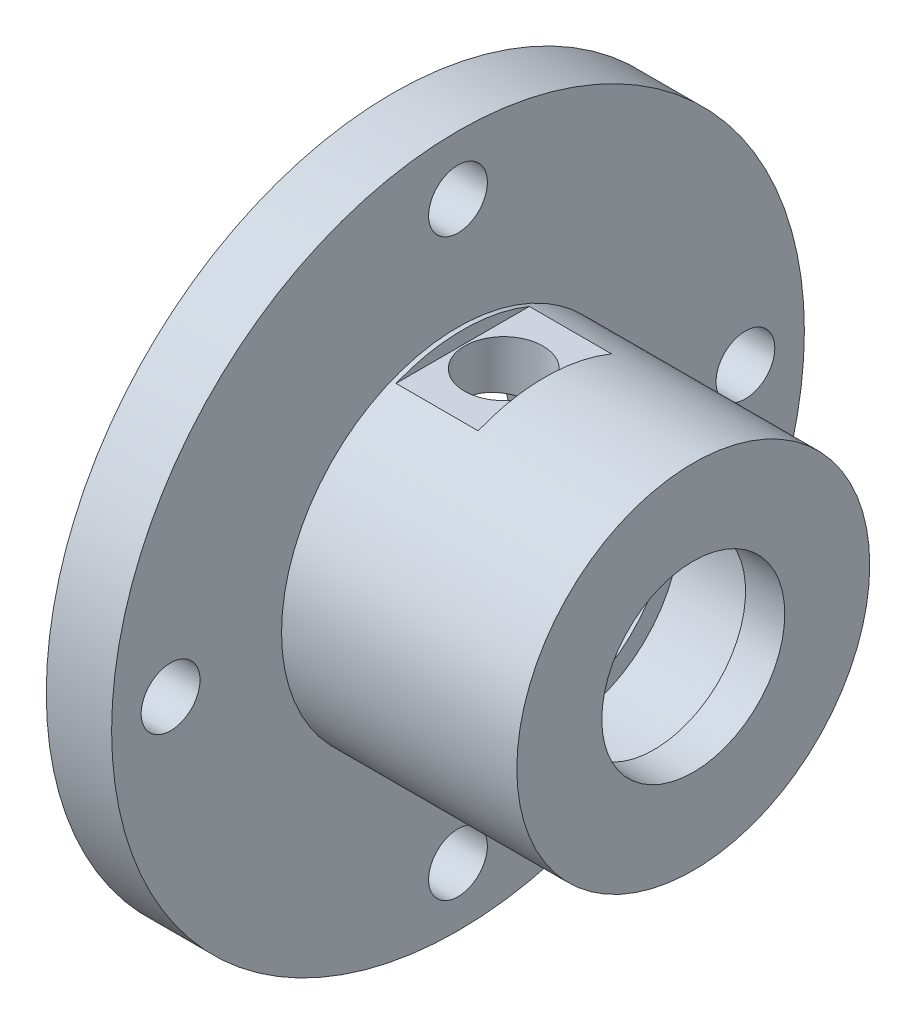
from build123d import *

# Parameters (mm, degrees)
SKETCH1_R           = 26.5
SKETCH1_R_2         = 2.25
BOSS_EXTRUDE1_DEPTH = 11.5
CUT_EXTRUDE1_START  = -18
SKETCH2_R           = 26.5
SKETCH2_R_2         = 2.25
SKETCH2_R_3         = 13.5
CUT_EXTRUDE1_DEPTH  = 18
SKETCH3_R           = 9
CUT_EXTRUDE2_DEPTH  = 20
SKETCH4_R           = 7
CUT_EXTRUDE3_DEPTH  = 20
SKETCH5_R           = 11
CUT_EXTRUDE4_DEPTH  = 0.5
SKETCH6_R           = 3
CUT_EXTRUDE5_DEPTH  = 33
SKETCH8_W           = 6.282269922
SKETCH8_H           = 12
CUT_EXTRUDE6_DEPTH  = 1


with BuildPart() as part:
    # Sketch1 → Boss-Extrude1 (new, symmetric)
    with BuildSketch(Plane(origin=(0, 0, 0), x_dir=(0, 0, -1), z_dir=(1, 0, 0))):
        Circle(SKETCH1_R)
        with Locations((0, -21.987670406)):
            Circle(SKETCH1_R_2, mode=Mode.SUBTRACT)
        with Locations((-21.987670406, 0)):
            Circle(SKETCH1_R_2, mode=Mode.SUBTRACT)
        with Locations((0, 21.987670406)):
            Circle(SKETCH1_R_2, mode=Mode.SUBTRACT)
        with Locations((21.987670406, 0)):
            Circle(SKETCH1_R_2, mode=Mode.SUBTRACT)
    extrude(amount=BOSS_EXTRUDE1_DEPTH, both=True)

    # Sketch2 → Cut-Extrude1 (cut)
    with BuildSketch(Plane(origin=(11.5, 0, 0), x_dir=(0, 0, -1), z_dir=(1, 0, 0)).offset(CUT_EXTRUDE1_START)):
        Circle(SKETCH2_R)
        with Locations((0, -21.987670406)):
            Circle(SKETCH2_R_2, mode=Mode.SUBTRACT)
        with Locations((-21.987670406, 0)):
            Circle(SKETCH2_R_2, mode=Mode.SUBTRACT)
        with Locations((0, 21.987670406)):
            Circle(SKETCH2_R_2, mode=Mode.SUBTRACT)
        Circle(SKETCH2_R_3, mode=Mode.SUBTRACT)
        with Locations((21.987670406, 0)):
            Circle(SKETCH2_R_2, mode=Mode.SUBTRACT)
    extrude(amount=CUT_EXTRUDE1_DEPTH, mode=Mode.SUBTRACT)

    # Sketch3 → Cut-Extrude2 (cut)
    with BuildSketch(Plane.ZY.offset(11.5)):
        Circle(SKETCH3_R)
    extrude(amount=-CUT_EXTRUDE2_DEPTH, mode=Mode.SUBTRACT)

    # Sketch4 → Cut-Extrude3 (cut)
    with BuildSketch(Plane.ZY.offset(-8.5)):
        Circle(SKETCH4_R)
    extrude(amount=-CUT_EXTRUDE3_DEPTH, mode=Mode.SUBTRACT)

    # Sketch5 → Cut-Extrude4 (cut, symmetric)
    with BuildSketch(Plane.ZY.offset(-1)):
        Circle(SKETCH5_R)
    extrude(amount=CUT_EXTRUDE4_DEPTH, both=True, mode=Mode.SUBTRACT)

    # Sketch6 → Cut-Extrude5 (cut)
    with BuildSketch(Plane(origin=(0, 0, 0), x_dir=(1, 0, 0), z_dir=(0, 1, 0))):
        with Locations((-3, 0)):
            Circle(SKETCH6_R)
    extrude(amount=CUT_EXTRUDE5_DEPTH, mode=Mode.SUBTRACT)

    # Sketch8 → Cut-Extrude6 (cut)
    with BuildSketch(Plane(origin=(0, 13.5, 0), x_dir=(1, 0, 0), z_dir=(0, 1, 0))):
        with Locations((-3, 0)):
            Rectangle(SKETCH8_W, SKETCH8_H)
    extrude(amount=-CUT_EXTRUDE6_DEPTH, mode=Mode.SUBTRACT)


solid = part.part
